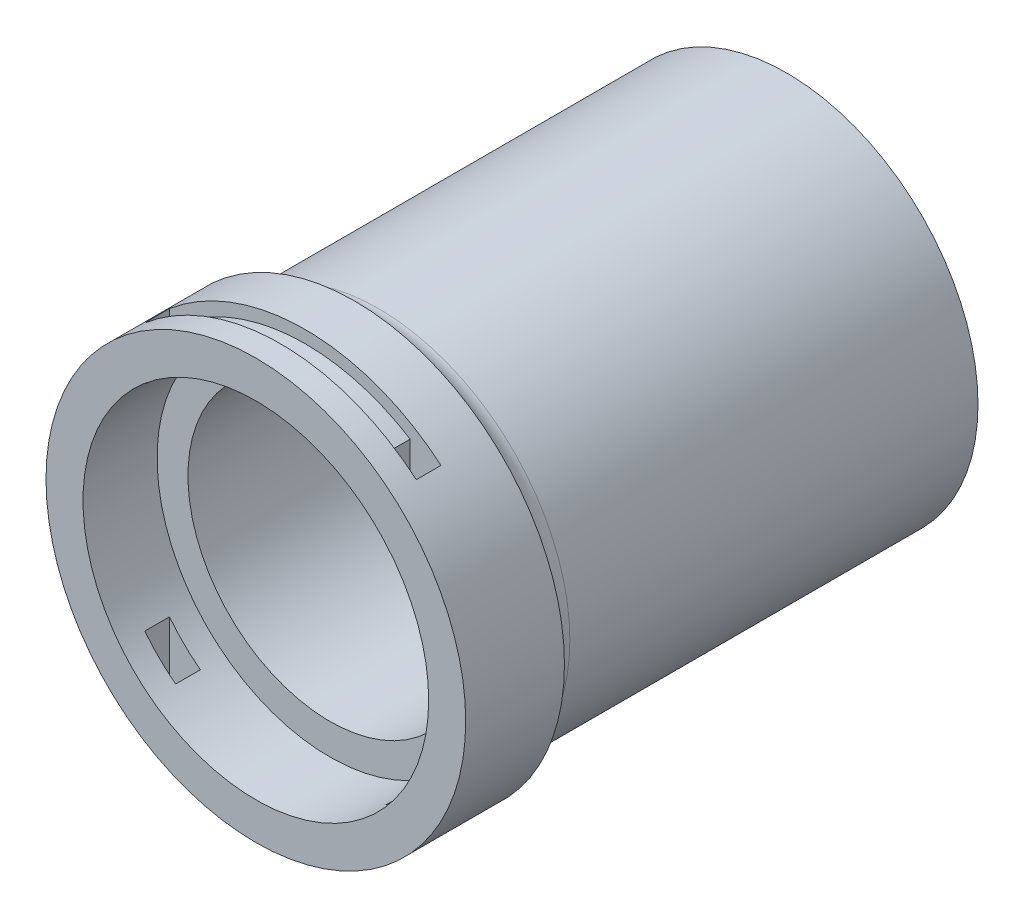
from build123d import *

# Parameters (mm, degrees)
BOSS_EXTRUDE5_DEPTH      = 26
BOSS_EXTRUDE5_DEPTH_BACK = 17
SKETCH1_R                = 15.5
SKETCH3_R                = 5.625
CUT_EXTRUDE2_DEPTH       = 49.264894074
CUT_EXTRUDE3_DEPTH       = 28
CUT_EXTRUDE3_DEPTH_BACK  = 20
SKETCH4_R                = 11.5
CUT_EXTRUDE6_START       = 6
SKETCH7_R                = 11.5
SKETCH7_R_2              = 8.5
CUT_EXTRUDE6_DEPTH       = 18
BOSS_EXTRUDE8_DEPTH      = 6
BOSS_EXTRUDE8_DEPTH_BACK = 2
BOSS_EXTRUDE8_START      = 20
SKETCH12_R               = 17
CUT_EXTRUDE10_START      = 18
SKETCH13_R               = 11.5
CUT_EXTRUDE10_DEPTH      = 18.411862419
FILLET2_R                = 2
CUT_EXTRUDE11_START      = 26
SKETCH14_R               = 14
CUT_EXTRUDE11_DEPTH      = 6
CUT_EXTRUDE14_DEPTH      = 36.411862419
CUT_EXTRUDE14_DEPTH_BACK = 36.411862419
SKETCH15_R               = 0.5
SKETCH18_W               = 2.5
SKETCH18_H               = 2
CUT_EXTRUDE15_DEPTH      = 20
CUT_EXTRUDE16_DEPTH      = 2
SKETCH28_R               = 6.875
CUT_EXTRUDE17_DEPTH      = 16


with BuildPart() as part:
    # Sketch1 → Boss-Extrude5 (new, two sides: drawn at the far end of the back side and taken through both)
    with BuildSketch(Plane.XY.offset(-BOSS_EXTRUDE5_DEPTH_BACK)):
        Circle(SKETCH1_R)
    extrude(amount=BOSS_EXTRUDE5_DEPTH + BOSS_EXTRUDE5_DEPTH_BACK)

    # Sketch3 → Cut-Extrude2 (cut, through all)
    with BuildSketch(Plane.XY.offset(26)):
        Circle(SKETCH3_R)
    extrude(amount=-CUT_EXTRUDE2_DEPTH, mode=Mode.SUBTRACT)

    # Sketch4 → Cut-Extrude3 (cut, two sides: drawn at the far end of the back side and taken through both)
    with BuildSketch(Plane.XY.offset(26).offset(-CUT_EXTRUDE3_DEPTH_BACK)):
        Circle(SKETCH4_R)
    extrude(amount=CUT_EXTRUDE3_DEPTH + CUT_EXTRUDE3_DEPTH_BACK, mode=Mode.SUBTRACT)

    # Sketch7 → Cut-Extrude6 (cut)
    with BuildSketch(Plane.XY.offset(CUT_EXTRUDE6_START)):
        Circle(SKETCH7_R)
        Circle(SKETCH7_R_2, mode=Mode.SUBTRACT)
    extrude(amount=-CUT_EXTRUDE6_DEPTH, mode=Mode.SUBTRACT)

    # Sketch12 → Boss-Extrude8 (add, two sides: drawn at the far end of the back side and taken through both)
    with BuildSketch(Plane.XY.offset(BOSS_EXTRUDE8_START - BOSS_EXTRUDE8_DEPTH_BACK)):
        Circle(SKETCH12_R)
    extrude(amount=BOSS_EXTRUDE8_DEPTH + BOSS_EXTRUDE8_DEPTH_BACK)

    # Sketch13 → Cut-Extrude10 (cut, through all)
    with BuildSketch(Plane.XY.offset(CUT_EXTRUDE10_START)):
        Circle(SKETCH13_R)
    extrude(amount=CUT_EXTRUDE10_DEPTH, mode=Mode.SUBTRACT)

    # Fillet2
    # the kernel refuses this fillet: 2 mm, written as the material it adds along each edge
    with BuildSketch(Plane(origin=(0, 0, 18), x_dir=(1, 0, 0), z_dir=(0, 1, 0))) as fillet2_piece_1:
        with BuildLine():
            CenterArc((17.5, 1.936491673), FILLET2_R, 180, 75.522487814)
            Line((17, 0), (16.99, -0.038729833))
            ThreePointArc((16.99, -0.038729833), (16.25, -0.04), (15.5, -0.04))
            Line((15.5, -0.04), (15.46, 0))
            Line((15.46, 0), (15.46, 1.936491673))
            Line((15.46, 1.936491673), (15.5, 1.936491673))
        make_face()
    revolve(axis=Axis((0, 0, 18), (0, 0, -1)))

    # Sketch14 → Cut-Extrude11 (cut)
    with BuildSketch(Plane.XY.offset(CUT_EXTRUDE11_START)):
        Circle(SKETCH14_R)
    extrude(amount=-CUT_EXTRUDE11_DEPTH, mode=Mode.SUBTRACT)

    # Sketch15 → Cut-Extrude14 (cut, two sides: drawn at the far end of the back side and taken through both)
    with BuildSketch(Plane.XY.offset(-CUT_EXTRUDE14_DEPTH_BACK)):
        with Locations((0, 10)):
            Circle(SKETCH15_R)
        with Locations((0, -10)):
            Circle(SKETCH15_R)
        with Locations((10, 0)):
            Circle(SKETCH15_R)
        with Locations((-10, 0)):
            Circle(SKETCH15_R)
    extrude(amount=CUT_EXTRUDE14_DEPTH + CUT_EXTRUDE14_DEPTH_BACK, mode=Mode.SUBTRACT)

    # Sketch18 → Cut-Extrude15 (cut, symmetric)
    with BuildSketch(Plane(origin=(0, 0, 0), x_dir=(1, 0, 0), z_dir=(0, 1, 0))):
        with Locations((-9.75, -23)):
            Rectangle(SKETCH18_W, SKETCH18_H)
        with Locations((9.75, -23)):
            Rectangle(SKETCH18_W, SKETCH18_H)
    extrude(amount=CUT_EXTRUDE15_DEPTH, both=True, mode=Mode.SUBTRACT)

    # Sketch23 → Cut-Extrude16 (cut)
    with BuildSketch(Plane(origin=(0, 0, 24), x_dir=(-1, 0, 0), z_dir=(0, 0, -1))):
        with BuildLine():
            Line((9.719197711, 13.947659153), (9.147480199, 13.127208615))
            ThreePointArc((9.147480199, 13.127208615), (0, 16), (-9.147480199, 13.127208615))
            Line((-9.147480199, 13.127208615), (-9.719197711, 13.947659153))
            ThreePointArc((-9.719197711, 13.947659153), (0, 17), (9.719197711, 13.947659153))
        make_face()
        with BuildLine():
            Line((-9.147480199, -13.127208615), (-9.719197711, -13.947659153))
            ThreePointArc((-9.719197711, -13.947659153), (0, -17), (9.719197711, -13.947659153))
            Line((9.719197711, -13.947659153), (9.147480199, -13.127208615))
            ThreePointArc((9.147480199, -13.127208615), (0, -16), (-9.147480199, -13.127208615))
        make_face()
    extrude(amount=CUT_EXTRUDE16_DEPTH, mode=Mode.SUBTRACT)

    # Sketch28 → Cut-Extrude17 (cut)
    with BuildSketch(Plane(origin=(0, 0, -17), x_dir=(-1, 0, 0), z_dir=(0, 0, -1))):
        Circle(SKETCH28_R)
    extrude(amount=-CUT_EXTRUDE17_DEPTH, mode=Mode.SUBTRACT)


solid = part.part
